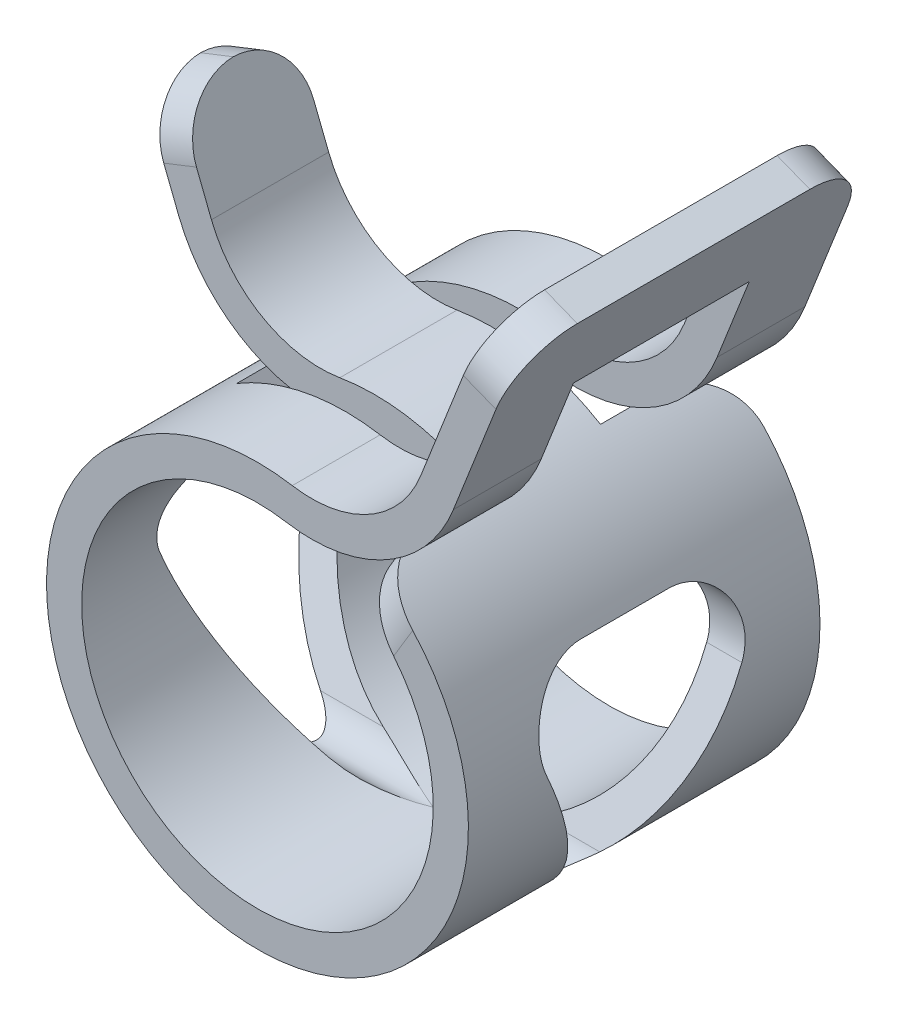
from build123d import *

# Parameters (mm, degrees)
CYLINDER_SKETCH_R               = 3.6
CYLINDER_SKETCH_R_2             = 3
CYLINDER_EXTRUDE_DEPTH          = 3
CUT_SIDE_SLOTS_DEPTH            = 12.7
CUT_SLOT_IN_TOP_DEPTH           = 8.868926397
FEMALE_BASE_SKETCH_W            = 1.5
FEMALE_BASE_SKETCH_H            = 0.6
FEMALE_BASE_ANGLE               = 40.5
FEMALE_TRANSITION_SKETCH_W      = 1.5
FEMALE_TRANSITION_SKETCH_H      = 0.6
FEMALE_TRANSITION_REVOLVE_ANGLE = 78
FEMALE_LEVER_SKETCH_W           = 0.6
FEMALE_LEVER_SKETCH_H           = 1.5
FEMALE_LEVER_EXTRUDE_DEPTH      = 1.5
FEMALE_TOP_SKETCH_W             = 0.6
FEMALE_TOP_SKETCH_H             = 6
FEMALE_TOP_EXTRUDE_DEPTH        = 1.5
MALE_BASE_SKETCH_W              = 2
MALE_BASE_SKETCH_H              = 0.6
MALE_BASE_ANGLE                 = 40.5
MALE_TRANSITION_SKETCH_W        = 2
MALE_TRANSITION_SKETCH_H        = 0.6
MALE_TRANSITION_REVOLVE_ANGLE   = 78
MALE_LEVER_SKETCH_W             = 0.6
MALE_LEVER_SKETCH_H             = 2
MALE_LEVER_EXTRUDE_DEPTH        = 1.714285714
FILLETS_R                       = 1.016


with BuildPart() as part:
    # Cylinder Sketch → Cylinder Extrude (new, symmetric)
    with BuildSketch(Plane.XY):
        Circle(CYLINDER_SKETCH_R)
        Circle(CYLINDER_SKETCH_R_2, mode=Mode.SUBTRACT)
    extrude(amount=CYLINDER_EXTRUDE_DEPTH, both=True)

    # Side Slot Sketch → Cut Side Slots (cut, symmetric)
    with BuildSketch(Plane(origin=(0, 0, 0), x_dir=(0, 0, -1), z_dir=(1, 0, 0))):
        with BuildLine():
            Line((-0.75, 1.5), (0.75, 1.5))
            ThreePointArc((0.75, 1.5), (1.585525874, 1.049451102), (1.668161225, 0.103793027))
            Line((1.668161225, 0.103793027), (0.459080612, -2.698103486))
            ThreePointArc((0.459080612, -2.698103486), (0, -3), (-0.459080612, -2.698103486))
            Line((-0.459080612, -2.698103486), (-1.668161225, 0.103793027))
            ThreePointArc((-1.668161225, 0.103793027), (-1.585525874, 1.049451102), (-0.75, 1.5))
        make_face()
    extrude(amount=CUT_SIDE_SLOTS_DEPTH, both=True, mode=Mode.SUBTRACT)

    # Top Slot Sketch → Cut Slot in Top (cut, through all)
    with BuildSketch(Plane.XY.offset(3)):
        Polygon((-2.163098228, 3.6), (0, 0), (2.163098228, 3.6), align=None)
    extrude(amount=-CUT_SLOT_IN_TOP_DEPTH, mode=Mode.SUBTRACT)

    # Female Base Sketch → Female Base (revolve)
    with BuildSketch(Plane(origin=(0, 0, 0), x_dir=(0, 0, -1), z_dir=(0.8571673007021136, 0.515038074910052, 0))):
        with Locations((-2.25, 3.3)):
            Rectangle(FEMALE_BASE_SKETCH_W, FEMALE_BASE_SKETCH_H)
        with Locations((2.25, 3.3)):
            Rectangle(FEMALE_BASE_SKETCH_W, FEMALE_BASE_SKETCH_H)
    revolve(axis=Axis((0, 0, 0), (0, 0, -1)), revolution_arc=FEMALE_BASE_ANGLE)

    # Female Transition Sketch → Female Transition Revolve (revolve)
    with BuildSketch(Plane(origin=(0, 0, 0), x_dir=(0, 0, -1), z_dir=(0.9862856015372308, -0.16504760586068196, 0))):
        with Locations((2.25, 3.3)):
            Rectangle(FEMALE_TRANSITION_SKETCH_W, FEMALE_TRANSITION_SKETCH_H)
        with Locations((-2.25, 3.3)):
            Rectangle(FEMALE_TRANSITION_SKETCH_W, FEMALE_TRANSITION_SKETCH_H)
    revolve(axis=Axis((0.924266593, 5.523199369, 1.5), (0, 0, 1)), revolution_arc=FEMALE_TRANSITION_REVOLVE_ANGLE)

    # Female Lever Sketch → Female Lever Extrude (add)
    with BuildSketch(Plane(origin=(2.007556855, 5.096479986, 0), x_dir=(0.9304175679820241, -0.3665012267242986, 0), z_dir=(0.3665012267242986, 0.9304175679820241, 0))):
        with Locations((1.135694531, 2.25)):
            Rectangle(FEMALE_LEVER_SKETCH_W, FEMALE_LEVER_SKETCH_H)
        with Locations((1.135694531, -2.25)):
            Rectangle(FEMALE_LEVER_SKETCH_W, FEMALE_LEVER_SKETCH_H)
    extrude(amount=FEMALE_LEVER_EXTRUDE_DEPTH)

    # Female Top Sketch → Female Top Extrude (add)
    with BuildSketch(Plane(origin=(2.557308695, 6.492106338, 0), x_dir=(0.930417567982024, -0.3665012267242986, 0), z_dir=(0.3665012267242986, 0.9304175679820241, 0))):
        with Locations((1.135694531, 0)):
            Rectangle(FEMALE_TOP_SKETCH_W, FEMALE_TOP_SKETCH_H)
    extrude(amount=FEMALE_TOP_EXTRUDE_DEPTH)

    # Male Base Sketch → Male Base (revolve)
    with BuildSketch(Plane(origin=(0, 0, 0), x_dir=(0, 0, 1), z_dir=(-0.8571673007021136, 0.515038074910052, 0))):
        with Locations((0, 3.3)):
            Rectangle(MALE_BASE_SKETCH_W, MALE_BASE_SKETCH_H)
    revolve(axis=Axis((0, 0, 0), (0, 0, 1)), revolution_arc=MALE_BASE_ANGLE)

    # Male Transition Sketch → Male Transition Revolve (revolve)
    with BuildSketch(Plane(origin=(0, 0, 0), x_dir=(0, 0, 1), z_dir=(-0.9862856015372308, -0.16504760586068182, 0))):
        with Locations((0, 3.3)):
            Rectangle(MALE_TRANSITION_SKETCH_W, MALE_TRANSITION_SKETCH_H)
    revolve(axis=Axis((-0.924266593, 5.523199369, -1), (0, 0, -1)), revolution_arc=MALE_TRANSITION_REVOLVE_ANGLE)

    # Male Lever Sketch → Male Lever Extrude (add)
    with BuildSketch(Plane(origin=(-2.007556855, 5.096479986, 0), x_dir=(0.9304175679820241, 0.3665012267242986, 0), z_dir=(-0.3665012267242986, 0.9304175679820241, 0))):
        with Locations((-1.135694531, 0)):
            Rectangle(MALE_LEVER_SKETCH_W, MALE_LEVER_SKETCH_H)
    extrude(amount=MALE_LEVER_EXTRUDE_DEPTH)

    # Fillets
    # the kernel refuses this fillet: 1.016 mm, written as the material it takes off along each edge
    with BuildSketch(Plane(origin=(0.236917514, 0.394296958, -3), x_dir=(0.8571673007021136, -0.5150380749100519, 0), z_dir=(0.515038074910052, 0.8571673007021137, 0))) as fillets_piece_1_section:
        with BuildLine():
            CenterArc((FILLETS_R, -FILLETS_R), FILLETS_R, 90, 90)
            Line((0, -FILLETS_R), (0, 0))
            Line((0, 0), (FILLETS_R, 0))
        make_face()
    fillets_piece_1 = extrude(amount=5.68, mode=Mode.PRIVATE)
    fillets_piece_1 = fillets_piece_1 & Plane(origin=(0, 0, -2.773460416), x_dir=(1, 0, 0), z_dir=(0, 0, 1)) * Cylinder(3.6, 16, mode=Mode.PRIVATE)
    add(fillets_piece_1, mode=Mode.SUBTRACT)
    with BuildSketch(Plane(origin=(0.236917514, 0.394296958, 3), x_dir=(0, 0, -1), z_dir=(0.515038074910052, 0.8571673007021137, 0))) as fillets_piece_2_section:
        with BuildLine():
            CenterArc((FILLETS_R, -FILLETS_R), FILLETS_R, 90, 90)
            Line((0, -FILLETS_R), (0, 0))
            Line((0, 0), (FILLETS_R, 0))
        make_face()
    fillets_piece_2 = extrude(amount=5.68, mode=Mode.PRIVATE)
    fillets_piece_2 = fillets_piece_2 & Plane(origin=(0, 0, 2.773461153), x_dir=(1, 0, 0), z_dir=(0, 0, 1)) * Cylinder(3.6, 16, mode=Mode.PRIVATE)
    add(fillets_piece_2, mode=Mode.SUBTRACT)
    with BuildSketch(Plane(origin=(-6.334900709, 5.234384608, 1), x_dir=(0.3665012267242986, -0.930417567982024, 0), z_dir=(0.9304175679820241, 0.3665012267242986, 0)), Plane(origin=(-1.050128923, 7.316111576, -1), x_dir=(0.3665012267242985, -0.930417567982024, 0), z_dir=(-0.9304175679820241, -0.3665012267242986, 0))) as fillets_piece_3:
        with BuildLine():
            CenterArc((FILLETS_R, FILLETS_R), FILLETS_R, 180, 90)
            Line((0, FILLETS_R), (0, 0))
            Line((0, 0), (FILLETS_R, 0))
        make_face()
    extrude(amount=5.68, mode=Mode.SUBTRACT)
    with BuildSketch(Plane(origin=(1.521344786, 8.512362735, -3), x_dir=(-0.3665012267242986, -0.930417567982024, 0), z_dir=(0.9304175679820241, -0.3665012267242986, 0)), Plane(origin=(6.806116572, 6.430635767, 3), x_dir=(-0.3665012267242985, -0.930417567982024, 0), z_dir=(-0.9304175679820241, 0.3665012267242986, 0))) as fillets_piece_4:
        with BuildLine():
            CenterArc((FILLETS_R, -FILLETS_R), FILLETS_R, 90, 90)
            Line((0, -FILLETS_R), (0, 0))
            Line((0, 0), (FILLETS_R, 0))
        make_face()
    extrude(amount=5.68, mode=Mode.SUBTRACT)


solid = part.part
